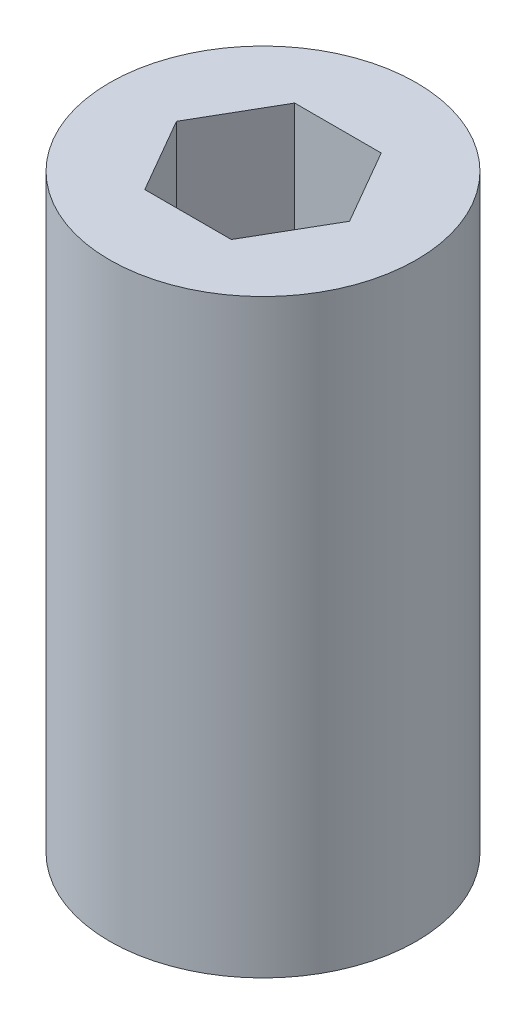
from build123d import *

# Parameters (mm, degrees)
SKETCH1_R           = 13
BOSS_EXTRUDE1_DEPTH = 30
BOSS_EXTRUDE2_START = 20
SKETCH2_R           = 13
BOSS_EXTRUDE2_DEPTH = 20
CUT_EXTRUDE1_DEPTH  = 21


with BuildPart() as part:
    # Sketch1 → Boss-Extrude1 (new body)
    with BuildSketch(Plane(origin=(0, 0, 0), x_dir=(1, 0, 0), z_dir=(0, 1, 0))):
        Circle(SKETCH1_R)
        Polygon((7.332348419, 0), (3.666174209, 6.35), (-3.666174209, 6.35), (-7.332348419, 0), (-3.666174209, -6.35), (3.666174209, -6.35), align=None, mode=Mode.SUBTRACT)
    extrude(amount=BOSS_EXTRUDE1_DEPTH)

    # Sketch2 → Boss-Extrude2 (add)
    with BuildSketch(Plane.XZ.offset(BOSS_EXTRUDE2_START)):
        Circle(SKETCH2_R)
    extrude(amount=-BOSS_EXTRUDE2_DEPTH)

    # Sketch3 → Cut-Extrude1 (cut)
    with BuildSketch(Plane.XZ.offset(20)):
        with BuildLine():
            ThreePointArc((-5.530374824, 4.768800746), (-6.917240843, 5.376118942), (-8.388921413, 5.731631315))
            ThreePointArc((-8.388921413, 5.731631315), (-8.697099219, 5.252243823), (-8.977912733, 4.756330829))
            ThreePointArc((-8.977912733, 4.756330829), (-7.978175652, 3.619335441), (-6.795063644, 2.67462452))
            ThreePointArc((-6.795063644, 2.67462452), (-6.934341145, 2.289414584), (-7.051800643, 1.897001302))
            ThreePointArc((-7.051800643, 1.897001302), (-8.56482924, 1.842437475), (-10.045018654, 1.524204788))
            ThreePointArc((-10.045018654, 1.524204788), (-10.114678826, 0.958578243), (-10.152514476, 0.389935657))
            ThreePointArc((-10.152514476, 0.389935657), (-8.758458679, -0.200692129), (-7.282616886, -0.538514195))
            ThreePointArc((-7.282616886, -0.538514195), (-7.240965251, -0.946006599), (-7.17653086, -1.350522515))
            ThreePointArc((-7.17653086, -1.350522515), (-8.516048165, -2.056161329), (-9.711576757, -2.985109191))
            ThreePointArc((-9.711576757, -2.985109191), (-9.528922243, -3.524945515), (-9.316286214, -4.053691055))
            ThreePointArc((-9.316286214, -4.053691055), (-7.804021549, -3.98097016), (-6.327758539, -3.64499357))
            ThreePointArc((-6.327758539, -3.64499357), (-6.113427384, -3.994059572), (-5.879861126, -4.330558785))
            ThreePointArc((-5.879861126, -4.330558785), (-6.780559309, -5.547512165), (-7.454637979, -6.903185685))
            ThreePointArc((-7.454637979, -6.903185685), (-7.055845746, -7.310310582), (-6.634853212, -7.694434538))
            ThreePointArc((-6.634853212, -7.694434538), (-5.303902242, -6.972768229), (-4.119610008, -6.029537265))
            ThreePointArc((-4.119610008, -6.029537265), (-3.775050248, -6.251040063), (-3.418612784, -6.452874777))
            ThreePointArc((-3.418612784, -6.452874777), (-3.702097523, -7.940110181), (-3.721216724, -9.454001592))
            ThreePointArc((-3.721216724, -9.454001592), (-3.185272464, -9.647778984), (-2.639306159, -9.811200895))
            ThreePointArc((-2.639306159, -9.811200895), (-1.753280047, -8.583524034), (-1.095522191, -7.219857158))
            ThreePointArc((-1.095522191, -7.219857158), (-0.688978112, -7.269925406), (-0.280266253, -7.29711978))
            ThreePointArc((-0.280266253, -7.29711978), (0.10961008, -8.760071997), (0.749237141, -10.132336537))
            ThreePointArc((0.749237141, -10.132336537), (1.316183094, -10.074386436), (1.878987847, -9.984738588))
            ThreePointArc((1.878987847, -9.984738588), (2.144600763, -8.494207634), (2.145547231, -6.980195794))
            ThreePointArc((2.145547231, -6.980195794), (2.533554589, -6.848912862), (2.913590446, -6.696080717))
            ThreePointArc((2.913590446, -6.696080717), (3.899608063, -7.844994118), (5.071295402, -8.803837967))
            ThreePointArc((5.071295402, -8.803837967), (5.556952448, -8.5056381), (6.025125266, -8.180676349))
            ThreePointArc((6.025125266, -8.180676349), (5.617717091, -6.722509238), (4.961664711, -5.358021047))
            ThreePointArc((4.961664711, -5.358021047), (5.254285731, -5.07138913), (5.530374824, -4.768800746))
            ThreePointArc((5.530374824, -4.768800746), (6.917240843, -5.376118942), (8.388921413, -5.731631315))
            ThreePointArc((8.388921413, -5.731631315), (8.697099219, -5.252243823), (8.977912733, -4.756330829))
            ThreePointArc((8.977912733, -4.756330829), (7.978175652, -3.619335441), (6.795063644, -2.67462452))
            ThreePointArc((6.795063644, -2.67462452), (6.934341145, -2.289414584), (7.051800643, -1.897001302))
            ThreePointArc((7.051800643, -1.897001302), (8.56482924, -1.842437475), (10.045018654, -1.524204788))
            ThreePointArc((10.045018654, -1.524204788), (10.114678826, -0.958578243), (10.152514476, -0.389935657))
            ThreePointArc((10.152514476, -0.389935657), (8.758458679, 0.200692129), (7.282616886, 0.538514195))
            ThreePointArc((7.282616886, 0.538514195), (7.240965251, 0.946006599), (7.17653086, 1.350522515))
            ThreePointArc((7.17653086, 1.350522515), (8.516048165, 2.056161329), (9.711576757, 2.985109191))
            ThreePointArc((9.711576757, 2.985109191), (9.528922243, 3.524945515), (9.316286214, 4.053691055))
            ThreePointArc((9.316286214, 4.053691055), (7.804021549, 3.98097016), (6.327758539, 3.64499357))
            ThreePointArc((6.327758539, 3.64499357), (6.113427384, 3.994059572), (5.879861126, 4.330558785))
            ThreePointArc((5.879861126, 4.330558785), (6.780559309, 5.547512165), (7.454637979, 6.903185685))
            ThreePointArc((7.454637979, 6.903185685), (7.055845746, 7.310310582), (6.634853212, 7.694434538))
            ThreePointArc((6.634853212, 7.694434538), (5.303902242, 6.972768229), (4.119610008, 6.029537265))
            ThreePointArc((4.119610008, 6.029537265), (3.775050248, 6.251040063), (3.418612784, 6.452874777))
            ThreePointArc((3.418612784, 6.452874777), (3.702097523, 7.940110181), (3.721216724, 9.454001592))
            ThreePointArc((3.721216724, 9.454001592), (3.185272464, 9.647778984), (2.639306159, 9.811200895))
            ThreePointArc((2.639306159, 9.811200895), (1.753280047, 8.583524034), (1.095522191, 7.219857158))
            ThreePointArc((1.095522191, 7.219857158), (0.688978112, 7.269925406), (0.280266253, 7.29711978))
            ThreePointArc((0.280266253, 7.29711978), (-0.10961008, 8.760071997), (-0.749237141, 10.132336537))
            ThreePointArc((-0.749237141, 10.132336537), (-1.316183094, 10.074386436), (-1.878987847, 9.984738588))
            ThreePointArc((-1.878987847, 9.984738588), (-2.144600763, 8.494207634), (-2.145547231, 6.980195794))
            ThreePointArc((-2.145547231, 6.980195794), (-2.533554589, 6.848912862), (-2.913590446, 6.696080717))
            ThreePointArc((-2.913590446, 6.696080717), (-3.899608063, 7.844994118), (-5.071295402, 8.803837967))
            ThreePointArc((-5.071295402, 8.803837967), (-5.556952448, 8.5056381), (-6.025125266, 8.180676349))
            ThreePointArc((-6.025125266, 8.180676349), (-5.617717091, 6.722509238), (-4.961664711, 5.358021047))
            ThreePointArc((-4.961664711, 5.358021047), (-5.254285731, 5.07138913), (-5.530374824, 4.768800746))
        make_face()
    extrude(amount=-CUT_EXTRUDE1_DEPTH, mode=Mode.SUBTRACT)


solid = part.part
